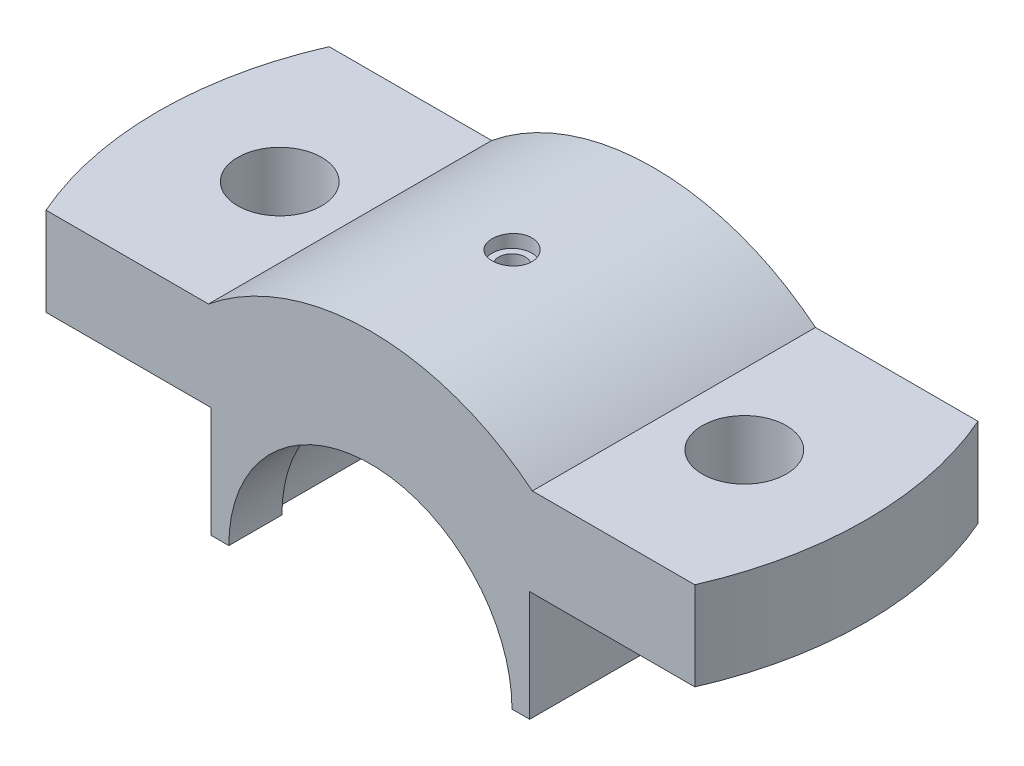
from build123d import *

# Parameters (mm, degrees)
BOSS_EXTRUDE1_DEPTH = 32
SKETCH2_R           = 9.5
CUT_EXTRUDE1_DEPTH  = 98.205966895
SKETCH3_R           = 34
CUT_EXTRUDE2_DEPTH  = 20
CUT_EXTRUDE3_START  = -20
CUT_EXTRUDE3_DEPTH  = 20
SKETCH5_R           = 4.5
CUT_EXTRUDE4_DEPTH  = 3
SKETCH6_R           = 3
CUT_EXTRUDE5_DEPTH  = 104.865297412


# Read off the part's stored shape, not the designer's step: Cut-Extrude3
with BuildPart() as part:
    # Sketch1 → Boss-Extrude1 (new, symmetric)
    with BuildSketch(Plane.XY):
        with BuildLine():
            Line((32, 0), (36, 0))
            Line((36, 0), (36, 25))
            Line((36, 25), (80, 25))
            Line((80, 25), (80, 45))
            Line((80, 45), (36.592348927, 45))
            ThreePointArc((36.592348927, 45), (19.416487839, 54.653453688), (0, 58))
            Line((0, 58), (0, 32))
            ThreePointArc((0, 32), (22.627416998, 22.627416998), (32, 0))
        make_face()
    boss_extrude1 = extrude(amount=BOSS_EXTRUDE1_DEPTH, both=True)

    # Sketch2 → Cut-Extrude1 (cut, through all)
    with BuildSketch(Plane(origin=(0, 45, 0), x_dir=(1, 0, 0), z_dir=(0, 1, 0))):
        with Locations(Location((52.5, 0, 0), (0, 0, 180))):
            Circle(SKETCH2_R)
    cut_extrude1 = extrude(amount=-CUT_EXTRUDE1_DEPTH, mode=Mode.SUBTRACT)

    # Sketch3 → Cut-Extrude2 (cut, symmetric)
    with BuildSketch(Plane.XY):
        Circle(SKETCH3_R)
    cut_extrude2 = extrude(amount=CUT_EXTRUDE2_DEPTH, both=True, mode=Mode.SUBTRACT)

    # Cut-Extrude3 outline → Cut-Extrude3 (cut)
    with BuildSketch(Plane(origin=(0, 45, 0), x_dir=(1, 0, 0), z_dir=(0, 1, 0)).offset(CUT_EXTRUDE3_START)):
        with BuildLine():
            ThreePointArc((73.321211119, 32), (78.312505014, 16.344771592), (80, 1.98e-07))
            Line((80, 1.98e-07), (80, 32))
            Line((80, 32), (73.321211119, 32))
        make_face()
        with BuildLine():
            ThreePointArc((80, 1.98e-07), (78.312505055, -16.344771398), (73.321211119, -32))
            Line((73.321211119, -32), (80, -32))
            Line((80, -32), (80, 1.98e-07))
        make_face()
    cut_extrude3 = extrude(amount=CUT_EXTRUDE3_DEPTH, mode=Mode.SUBTRACT)

    # Mirror1: Boss-Extrude1, Cut-Extrude1, Cut-Extrude2, Cut-Extrude3 across plane
    add(boss_extrude1.mirror(Plane(origin=(0, 32, 32), x_dir=(0, 0, 1), z_dir=(1, 0, 0))))
    add(cut_extrude1.mirror(Plane(origin=(0, 32, 32), x_dir=(0, 0, 1), z_dir=(1, 0, 0))), mode=Mode.SUBTRACT)
    add(cut_extrude2.mirror(Plane(origin=(0, 32, 32), x_dir=(0, 0, 1), z_dir=(1, 0, 0))), mode=Mode.SUBTRACT)
    add(cut_extrude3.mirror(Plane(origin=(0, 32, 32), x_dir=(0, 0, 1), z_dir=(1, 0, 0))), mode=Mode.SUBTRACT)

    # Sketch5 → Cut-Extrude4 (cut)
    with BuildSketch(Plane(origin=(0, 58, 0), x_dir=(1, 0, 0), z_dir=(0, 1, 0))):
        with Locations(Location((0, 0, 0), (0, 0, 270))):
            Circle(SKETCH5_R)
    extrude(amount=-CUT_EXTRUDE4_DEPTH, mode=Mode.SUBTRACT)

    # Sketch6 → Cut-Extrude5 (cut, through all)
    with BuildSketch(Plane(origin=(0, 58, 0), x_dir=(1, 0, 0), z_dir=(0, 1, 0))):
        with Locations(Location((0, 0, 0), (0, 0, 270))):
            Circle(SKETCH6_R)
    extrude(amount=-CUT_EXTRUDE5_DEPTH, mode=Mode.SUBTRACT)


solid = part.part
